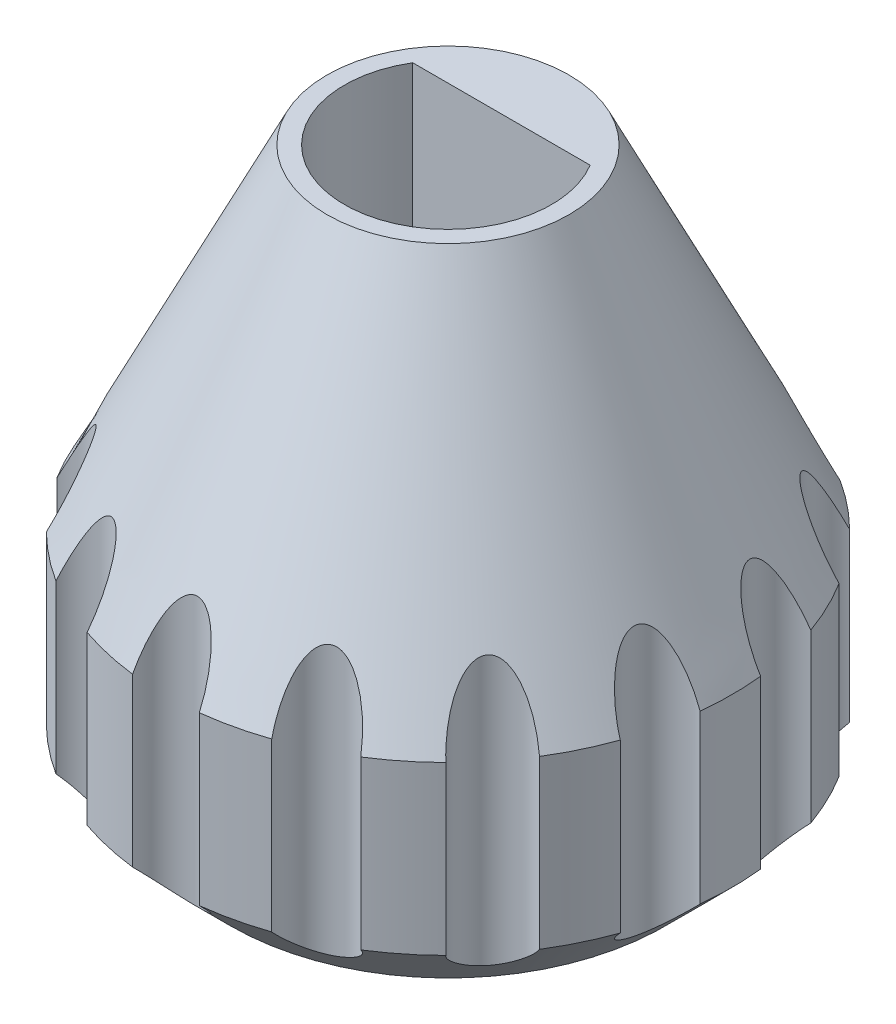
from build123d import *

# Parameters (mm, degrees)
SKETCH1_R           = 8.5
BOSS_EXTRUDE1_DEPTH = 7
SKETCH2_R           = 3.5
BOSS_EXTRUDE2_DEPTH = 10
CUT_EXTRUDE1_DEPTH  = 11
CHAMFER1_SIZE       = 5
CHAMFER1_SIZE_2     = 10.251519208
CHAMFER2_SIZE       = 2
CUT_EXTRUDE2_REACH  = 22.821
SKETCH4_R           = 1
CUT_EXTRUDE3_DEPTH  = 5
CHAMFER3_SIZE       = 0.1


# Some blends are built 0.0001 mm under size
with BuildPart() as part:
    # Sketch1 → Boss-Extrude1 (new body)
    with BuildSketch(Plane(origin=(0, 0, 0), x_dir=(1, 0, 0), z_dir=(0, 1, 0))):
        with Locations(Location((0, 0, 0), (0, 0, 270))):
            Circle(SKETCH1_R)
    extrude(amount=BOSS_EXTRUDE1_DEPTH)

    # Sketch2 → Boss-Extrude2 (add)
    with BuildSketch(Plane(origin=(0, 7, 0), x_dir=(1, 0, 0), z_dir=(0, 1, 0))):
        with Locations(Location((0, 0, 0), (0, 0, 270))):
            Circle(SKETCH2_R)
    extrude(amount=BOSS_EXTRUDE2_DEPTH)

    # Sketch3 → Cut-Extrude1 (cut)
    with BuildSketch(Plane(origin=(0, 17, 0), x_dir=(1, 0, 0), z_dir=(0, 1, 0))):
        with BuildLine():
            Line((-2.655183609, 1.6), (2.655183609, 1.6))
            ThreePointArc((2.655183609, 1.6), (0, -3.1), (-2.655183609, 1.6))
        make_face()
    extrude(amount=-CUT_EXTRUDE1_DEPTH, mode=Mode.SUBTRACT)

    # Chamfer1
    # the kernel refuses this chamfer: 10.251519208, 5 mm, written as the material it adds along each edge
    with BuildSketch(Plane(origin=(0, 7, 0), x_dir=(0, 0, 1), z_dir=(-1, 0, 0))) as chamfer1_piece_1_section:
        Polygon((3.5 + CHAMFER1_SIZE, 0), (3.5, CHAMFER1_SIZE_2), (3.5, 0), align=None)
    chamfer1_piece_1 = revolve(axis=Axis((0, 7, 0), (0, 1, 0)), mode=Mode.PRIVATE)
    chamfer1_piece_1 = chamfer1_piece_1 & Plane(origin=(0, 11.957167451, 0), x_dir=(0, 0, 1), z_dir=(0, -1, 0)) * Cylinder(8.5, 42, mode=Mode.PRIVATE)
    chamfer1_piece_1 = split(chamfer1_piece_1, bisect_by=Plane(origin=(0, 17, -5.973517317), z_dir=(0, -1, 0)), keep=Keep.TOP, mode=Mode.PRIVATE)
    add(chamfer1_piece_1)

    # Chamfer2
    chamfer2_edges = [part.edges().sort_by_distance(p)[0] for p in [
        (0, 0, -8.5),
    ]]
    chamfer(chamfer2_edges, length=CHAMFER2_SIZE)

    # Cut-Extrude2: up to this cone (the profile starts inside it)
    cut_extrude2_end = Plane(origin=(0, 0, 0), z_dir=(0, -1, 0)).offset(-24.427581653) * Cone(1e-06, 29.099448366, 59.662709773, align=(Align.CENTER, Align.CENTER, Align.MIN), mode=Mode.PRIVATE)
    # Sketch4 → Cut-Extrude2 (cut, up to the surface)
    with BuildSketch(Plane.XZ, mode=Mode.PRIVATE) as cut_extrude2_sk1:
        with Locations((0, 8.5)):
            Circle(SKETCH4_R)
    cut_extrude2_tool1 = extrude(cut_extrude2_sk1.sketch, amount=-CUT_EXTRUDE2_REACH, mode=Mode.PRIVATE) & cut_extrude2_end
    add(cut_extrude2_tool1.solids().sort_by_distance((0, 0, 8.5))[0], mode=Mode.SUBTRACT)
    # Sketch4 → Cut-Extrude2 (cut, up to the surface)
    with BuildSketch(Plane.XZ, mode=Mode.PRIVATE) as cut_extrude2_sk2:
        with Locations((3.688011782, 7.658235377)):
            Circle(SKETCH4_R)
    cut_extrude2_tool2 = extrude(cut_extrude2_sk2.sketch, amount=-CUT_EXTRUDE2_REACH, mode=Mode.PRIVATE) & cut_extrude2_end
    add(cut_extrude2_tool2.solids().sort_by_distance((3.688012, 0, 7.658235))[0], mode=Mode.SUBTRACT)
    # Sketch4 → Cut-Extrude2 (cut, up to the surface)
    with BuildSketch(Plane.XZ, mode=Mode.PRIVATE) as cut_extrude2_sk3:
        with Locations((6.645567601, 5.299663316)):
            Circle(SKETCH4_R)
    cut_extrude2_tool3 = extrude(cut_extrude2_sk3.sketch, amount=-CUT_EXTRUDE2_REACH, mode=Mode.PRIVATE) & cut_extrude2_end
    add(cut_extrude2_tool3.solids().sort_by_distance((6.645568, 0, 5.299663))[0], mode=Mode.SUBTRACT)
    # Sketch4 → Cut-Extrude2 (cut, up to the surface)
    with BuildSketch(Plane.XZ, mode=Mode.PRIVATE) as cut_extrude2_sk4:
        with Locations((8.286887254, 1.891427939)):
            Circle(SKETCH4_R)
    cut_extrude2_tool4 = extrude(cut_extrude2_sk4.sketch, amount=-CUT_EXTRUDE2_REACH, mode=Mode.PRIVATE) & cut_extrude2_end
    add(cut_extrude2_tool4.solids().sort_by_distance((8.286887, 0, 1.891428))[0], mode=Mode.SUBTRACT)
    # Sketch4 → Cut-Extrude2 (cut, up to the surface)
    with BuildSketch(Plane.XZ, mode=Mode.PRIVATE) as cut_extrude2_sk5:
        with Locations((8.286887254, -1.891427939)):
            Circle(SKETCH4_R)
    cut_extrude2_tool5 = extrude(cut_extrude2_sk5.sketch, amount=-CUT_EXTRUDE2_REACH, mode=Mode.PRIVATE) & cut_extrude2_end
    add(cut_extrude2_tool5.solids().sort_by_distance((8.286887, 0, -1.891428))[0], mode=Mode.SUBTRACT)
    # Sketch4 → Cut-Extrude2 (cut, up to the surface)
    with BuildSketch(Plane.XZ, mode=Mode.PRIVATE) as cut_extrude2_sk6:
        with Locations((6.645567601, -5.299663316)):
            Circle(SKETCH4_R)
    cut_extrude2_tool6 = extrude(cut_extrude2_sk6.sketch, amount=-CUT_EXTRUDE2_REACH, mode=Mode.PRIVATE) & cut_extrude2_end
    add(cut_extrude2_tool6.solids().sort_by_distance((6.645568, 0, -5.299663))[0], mode=Mode.SUBTRACT)
    # Sketch4 → Cut-Extrude2 (cut, up to the surface)
    with BuildSketch(Plane.XZ, mode=Mode.PRIVATE) as cut_extrude2_sk7:
        with Locations((3.688011782, -7.658235377)):
            Circle(SKETCH4_R)
    cut_extrude2_tool7 = extrude(cut_extrude2_sk7.sketch, amount=-CUT_EXTRUDE2_REACH, mode=Mode.PRIVATE) & cut_extrude2_end
    add(cut_extrude2_tool7.solids().sort_by_distance((3.688012, 0, -7.658235))[0], mode=Mode.SUBTRACT)
    # Sketch4 → Cut-Extrude2 (cut, up to the surface)
    with BuildSketch(Plane.XZ, mode=Mode.PRIVATE) as cut_extrude2_sk8:
        with Locations((0, -8.5)):
            Circle(SKETCH4_R)
    cut_extrude2_tool8 = extrude(cut_extrude2_sk8.sketch, amount=-CUT_EXTRUDE2_REACH, mode=Mode.PRIVATE) & cut_extrude2_end
    add(cut_extrude2_tool8.solids().sort_by_distance((0, 0, -8.5))[0], mode=Mode.SUBTRACT)
    # Sketch4 → Cut-Extrude2 (cut, up to the surface)
    with BuildSketch(Plane.XZ, mode=Mode.PRIVATE) as cut_extrude2_sk9:
        with Locations((-3.688011782, -7.658235377)):
            Circle(SKETCH4_R)
    cut_extrude2_tool9 = extrude(cut_extrude2_sk9.sketch, amount=-CUT_EXTRUDE2_REACH, mode=Mode.PRIVATE) & cut_extrude2_end
    add(cut_extrude2_tool9.solids().sort_by_distance((-3.688012, 0, -7.658235))[0], mode=Mode.SUBTRACT)
    # Sketch4 → Cut-Extrude2 (cut, up to the surface)
    with BuildSketch(Plane.XZ, mode=Mode.PRIVATE) as cut_extrude2_sk10:
        with Locations((-6.645567601, -5.299663316)):
            Circle(SKETCH4_R)
    cut_extrude2_tool10 = extrude(cut_extrude2_sk10.sketch, amount=-CUT_EXTRUDE2_REACH, mode=Mode.PRIVATE) & cut_extrude2_end
    add(cut_extrude2_tool10.solids().sort_by_distance((-6.645568, 0, -5.299663))[0], mode=Mode.SUBTRACT)
    # Sketch4 → Cut-Extrude2 (cut, up to the surface)
    with BuildSketch(Plane.XZ, mode=Mode.PRIVATE) as cut_extrude2_sk11:
        with Locations((-8.286887254, -1.891427939)):
            Circle(SKETCH4_R)
    cut_extrude2_tool11 = extrude(cut_extrude2_sk11.sketch, amount=-CUT_EXTRUDE2_REACH, mode=Mode.PRIVATE) & cut_extrude2_end
    add(cut_extrude2_tool11.solids().sort_by_distance((-8.286887, 0, -1.891428))[0], mode=Mode.SUBTRACT)
    # Sketch4 → Cut-Extrude2 (cut, up to the surface)
    with BuildSketch(Plane.XZ, mode=Mode.PRIVATE) as cut_extrude2_sk12:
        with Locations((-8.286887254, 1.891427939)):
            Circle(SKETCH4_R)
    cut_extrude2_tool12 = extrude(cut_extrude2_sk12.sketch, amount=-CUT_EXTRUDE2_REACH, mode=Mode.PRIVATE) & cut_extrude2_end
    add(cut_extrude2_tool12.solids().sort_by_distance((-8.286887, 0, 1.891428))[0], mode=Mode.SUBTRACT)
    # Sketch4 → Cut-Extrude2 (cut, up to the surface)
    with BuildSketch(Plane.XZ, mode=Mode.PRIVATE) as cut_extrude2_sk13:
        with Locations((-6.645567601, 5.299663316)):
            Circle(SKETCH4_R)
    cut_extrude2_tool13 = extrude(cut_extrude2_sk13.sketch, amount=-CUT_EXTRUDE2_REACH, mode=Mode.PRIVATE) & cut_extrude2_end
    add(cut_extrude2_tool13.solids().sort_by_distance((-6.645568, 0, 5.299663))[0], mode=Mode.SUBTRACT)
    # Sketch4 → Cut-Extrude2 (cut, up to the surface)
    with BuildSketch(Plane.XZ, mode=Mode.PRIVATE) as cut_extrude2_sk14:
        with Locations((-3.688011782, 7.658235377)):
            Circle(SKETCH4_R)
    cut_extrude2_tool14 = extrude(cut_extrude2_sk14.sketch, amount=-CUT_EXTRUDE2_REACH, mode=Mode.PRIVATE) & cut_extrude2_end
    add(cut_extrude2_tool14.solids().sort_by_distance((-3.688012, 0, 7.658235))[0], mode=Mode.SUBTRACT)

    # Sketch5 → Cut-Extrude3 (cut)
    with BuildSketch(Plane(origin=(0, 6, 0), x_dir=(1, 0, 0), z_dir=(0, 1, 0))):
        with BuildLine():
            Line((2.711088342, 1.7), (-2.711088342, 1.7))
            ThreePointArc((-2.711088342, 1.7), (0, -3.2), (2.711088342, 1.7))
        make_face()
    extrude(amount=CUT_EXTRUDE3_DEPTH, mode=Mode.SUBTRACT)

    # Chamfer3
    chamfer3_edges = [part.edges().sort_by_distance(p)[0] for p in [
        (0, 11, 3.2),
        (0, 11, -1.7),
    ]]
    chamfer(chamfer3_edges, length=CHAMFER3_SIZE - 0.0001)  # a hair under: the kernel refuses the full size


solid = part.part
